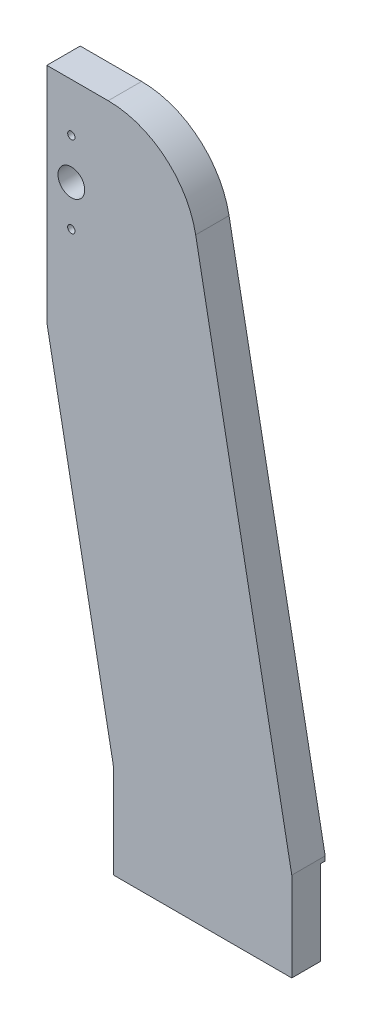
from build123d import *

# Parameters (mm, degrees)
SALIENTE_EXTRUIR1_DEPTH                        = 15
CROQUIS2_R                                     = 6
CORTAR_EXTRUIR1_DEPTH                          = 311.845620847
PERFORADOR_PARA_ROSCAR_PARA_MACHO_DE_ROS_D     = 3.3
PERFORADOR_PARA_ROSCAR_PARA_MACHO_DE_ROS_DEPTH = 7
PERFORADOR_PARA_ROSCAR_PARA_MACHO_DE_ROS_TIP   = 0.991420021
CROQUIS9_W                                     = 80
CROQUIS9_H                                     = 38
CORTAR_EXTRUIR2_DEPTH                          = 2
PERFORADOR_PARA_ROSCAR_PARA_MACHO_DE_2_D       = 3.3
PERFORADOR_PARA_ROSCAR_PARA_MACHO_DE_2_DEPTH   = 15
PERFORADOR_PARA_ROSCAR_PARA_MACHO_DE_2_TIP     = 0.991420021
TALADROS_DE_ESPIGA_DE_4_0MM1_D                 = 4
TALADROS_DE_ESPIGA_DE_4_0MM1_DEPTH             = 15
TALADROS_DE_ESPIGA_DE_4_0MM1_TIP               = 1.201721238


with BuildPart() as part:
    # Croquis1 → Saliente-Extruir1 (new body)
    with BuildSketch(Plane.XY):
        with BuildLine():
            Line((80, 0), (80, 40))
            Line((80, 40), (36.844749796, 267.45618268))
            ThreePointArc((36.844749796, 267.45618268), (23.058105258, 290.807850519), (-2.454173088, 300))
            Line((-2.454173088, 300), (-30, 300))
            Line((-30, 300), (-30, 200))
            Line((-30, 200), (-0.350538558, 43.72809134))
            ThreePointArc((-0.350538558, 43.72809134), (-0.087827481, 41.872267497), (0, 40))
            Line((0, 40), (0, 0))
            Line((0, 0), (80, 0))
        make_face()
    extrude(amount=SALIENTE_EXTRUIR1_DEPTH)

    # Croquis2 → Cortar-Extruir1 (cut, through all)
    with BuildSketch(Plane(origin=(0, 0, 0), x_dir=(-1, 0, 0), z_dir=(0, 0, -1))):
        with Locations((19, 260)):
            Circle(CROQUIS2_R)
    extrude(amount=-CORTAR_EXTRUIR1_DEPTH, mode=Mode.SUBTRACT)

    # Perforador para roscar para macho de ros
    with Locations(Plane.XY.offset(15)):
        with Locations((-19, 278.25), (-19, 241.75)):
            Hole(PERFORADOR_PARA_ROSCAR_PARA_MACHO_DE_ROS_D / 2, depth=PERFORADOR_PARA_ROSCAR_PARA_MACHO_DE_ROS_DEPTH)
            with Locations((0, 0, -(PERFORADOR_PARA_ROSCAR_PARA_MACHO_DE_ROS_DEPTH + PERFORADOR_PARA_ROSCAR_PARA_MACHO_DE_ROS_TIP / 2))):  # 118° drill point
                Cone(0, PERFORADOR_PARA_ROSCAR_PARA_MACHO_DE_ROS_D / 2, PERFORADOR_PARA_ROSCAR_PARA_MACHO_DE_ROS_TIP, mode=Mode.SUBTRACT)

    # Croquis9 → Cortar-Extruir2 (cut)
    with BuildSketch(Plane(origin=(0, 0, 0), x_dir=(-1, 0, 0), z_dir=(0, 0, -1))):
        with Locations((-40, 19)):
            Rectangle(CROQUIS9_W, CROQUIS9_H)
    extrude(amount=-CORTAR_EXTRUIR2_DEPTH, mode=Mode.SUBTRACT)

    # Perforador para roscar para macho de 2
    with Locations(Plane.ZY.offset(30)):
        with Locations((9, 285), (9, 235)):
            Hole(PERFORADOR_PARA_ROSCAR_PARA_MACHO_DE_2_D / 2, depth=PERFORADOR_PARA_ROSCAR_PARA_MACHO_DE_2_DEPTH)
            with Locations((0, 0, -(PERFORADOR_PARA_ROSCAR_PARA_MACHO_DE_2_DEPTH + PERFORADOR_PARA_ROSCAR_PARA_MACHO_DE_2_TIP / 2))):  # 118° drill point
                Cone(0, PERFORADOR_PARA_ROSCAR_PARA_MACHO_DE_2_D / 2, PERFORADOR_PARA_ROSCAR_PARA_MACHO_DE_2_TIP, mode=Mode.SUBTRACT)

    # Taladros de espiga de Ø4.0mm1
    with Locations(Plane.ZY.offset(30)):
        with Locations((9, 274), (9, 246)):
            Hole(TALADROS_DE_ESPIGA_DE_4_0MM1_D / 2, depth=TALADROS_DE_ESPIGA_DE_4_0MM1_DEPTH)
            with Locations((0, 0, -(TALADROS_DE_ESPIGA_DE_4_0MM1_DEPTH + TALADROS_DE_ESPIGA_DE_4_0MM1_TIP / 2))):  # 118° drill point
                Cone(0, TALADROS_DE_ESPIGA_DE_4_0MM1_D / 2, TALADROS_DE_ESPIGA_DE_4_0MM1_TIP, mode=Mode.SUBTRACT)


solid = part.part
